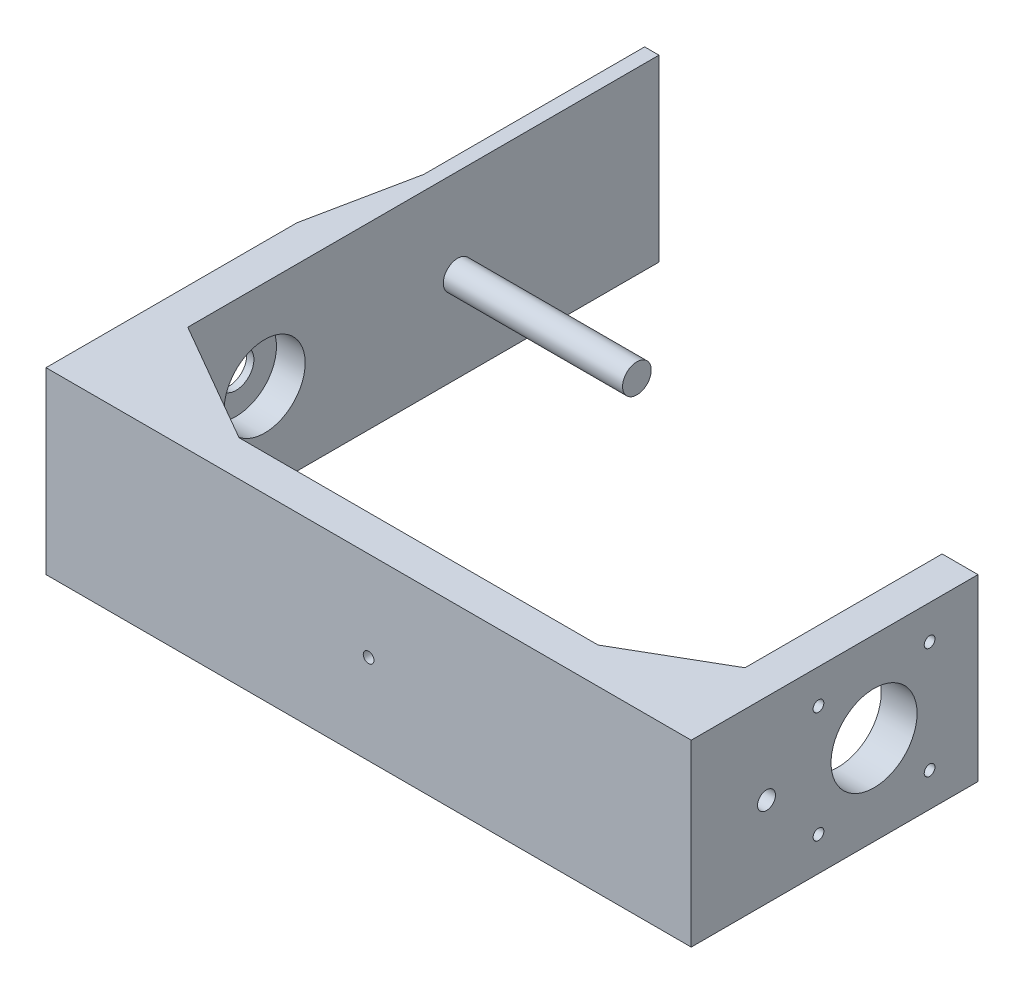
from build123d import *

# Parameters (mm, degrees)
BOSS_EXTRUDE1_DEPTH = 50
SKETCH3_R           = 2.5
SKETCH3_R_2         = 12
SKETCH3_R_3         = 1.5
CUT_EXTRUDE1_DEPTH  = 10
RIB1_REACH          = 129.376
SKETCH4_WALL_W      = 286.752677288
SKETCH4_WALL_H      = 6
MIRROR2_DEPTH       = 6
MIRROR2_START       = 44
MIRROR2_2_DEPTH     = 6
SKETCH5_R           = 11.3
SKETCH5_R_2         = 2.5
CUT_EXTRUDE2_DEPTH  = 8
SKETCH6_R           = 5
SKETCH6_R_2         = 0.75
CUT_EXTRUDE3_DEPTH  = 2
SKETCH8_W           = 4
SKETCH8_H           = 50
BOSS_EXTRUDE2_DEPTH = 91
BOSS_EXTRUDE3_DEPTH = 50
SKETCH11_R          = 1.5
CUT_EXTRUDE4_DEPTH  = 10
SKETCH12_R          = 4.004666462
BOSS_EXTRUDE4_DEPTH = 50


# Read off the part's stored shape, not the designer's step: Mirror2
with BuildPart() as part:
    # Sketch2 → Boss-Extrude1 (new body)
    with BuildSketch(Plane(origin=(0, 0, 0), x_dir=(1, 0, 0), z_dir=(0, 1, 0))):
        Polygon((-83.940042827, 0), (76.059957173, 0), (76.059957173, 70), (86.059957173, 70), (86.059957173, -10), (-93.940042827, -10), (-93.940042827, 60), (-83.940042827, 60), align=None)
    extrude(amount=BOSS_EXTRUDE1_DEPTH)

    # Sketch3 → Cut-Extrude1 (cut)
    with BuildSketch(Plane(origin=(86.059957173, 0, 0), x_dir=(0, 0, -1), z_dir=(1, 0, 0))):
        with Locations((11, 25)):
            Circle(SKETCH3_R)
        with Locations((41, 25)):
            Circle(SKETCH3_R_2)
        with Locations((25.500219356, 40.499780644)):
            Circle(SKETCH3_R_3)
        with Locations((56.499780644, 40.499780644)):
            Circle(SKETCH3_R_3)
        with Locations((56.499780644, 9.500219356)):
            Circle(SKETCH3_R_3)
        with Locations((25.500219356, 9.500219356)):
            Circle(SKETCH3_R_3)
    extrude(amount=-CUT_EXTRUDE1_DEPTH, mode=Mode.SUBTRACT)

    # Sketch4 wall → Rib1 (add, up to next)
    with BuildSketch(Plane(origin=(63.069576117, 50, -7.5), x_dir=(0.86602540378, 0, -0.500000000008), z_dir=(-0.500000000008, 0, -0.86602540378)), mode=Mode.PRIVATE) as rib1_sk1:
        with Locations((0, 3)):
            Rectangle(SKETCH4_WALL_W, SKETCH4_WALL_H)
    rib1_tool1 = extrude(rib1_sk1.sketch, amount=-RIB1_REACH, mode=Mode.PRIVATE) - part.part
    rib1 = rib1_tool1.solids().sort_by_distance((63.069576117, 50, -7.5))[0]
    add(rib1)

    # Mirror1: Rib1 across plane
    add(rib1.mirror(Plane.ZX.offset(25)))

    # Mirror2 outline → Mirror2 (add)
    with BuildSketch(Plane(origin=(0, 0, 0), x_dir=(1, 0, 0), z_dir=(0, 1, 0))):
        Polygon((-83.940042827, 0), (-50.07919506, 0), (-83.940042827, 19.549569573), align=None)
    extrude(amount=MIRROR2_DEPTH)

    # Mirror2 2 outline → Mirror2 2 (add)
    with BuildSketch(Plane(origin=(0, 0, 0), x_dir=(1, 0, 0), z_dir=(0, 1, 0)).offset(MIRROR2_START)):
        Polygon((-83.940042827, 0), (-50.07919506, 0), (-83.940042827, 19.549569573), align=None)
    extrude(amount=MIRROR2_2_DEPTH)

    # Sketch5 → Cut-Extrude2 (cut)
    with BuildSketch(Plane(origin=(-83.940042827, 0, 0), x_dir=(0, 0, -1), z_dir=(1, 0, 0))):
        with Locations((41, 25)):
            Circle(SKETCH5_R)
        with Locations((11, 25)):
            Circle(SKETCH5_R_2)
    extrude(amount=-CUT_EXTRUDE2_DEPTH, mode=Mode.SUBTRACT)

    # Sketch6 → Cut-Extrude3 (cut)
    with BuildSketch(Plane.ZY.offset(93.940042827)):
        with Locations((-41, 25)):
            Circle(SKETCH6_R)
        with Locations((-11, 25)):
            Circle(SKETCH6_R_2)
    extrude(amount=-CUT_EXTRUDE3_DEPTH, mode=Mode.SUBTRACT)

    # Sketch8 → Boss-Extrude2 (add)
    with BuildSketch(Plane(origin=(0, 0, -60), x_dir=(-1, 0, 0), z_dir=(0, 0, -1))):
        with Locations((85.940042827, 25)):
            Rectangle(SKETCH8_W, SKETCH8_H)
    extrude(amount=BOSS_EXTRUDE2_DEPTH)

    # Sketch9 → Boss-Extrude3 (add)
    with BuildSketch(Plane(origin=(0, 50, 0), x_dir=(1, 0, 0), z_dir=(0, 1, 0))):
        Polygon((-87.940042827, 89.393876913), (-93.940042827, 60), (-87.940042827, 60), align=None)
    extrude(amount=-BOSS_EXTRUDE3_DEPTH)

    # Sketch11 → Cut-Extrude4 (cut)
    with BuildSketch(Plane.XY.offset(10)):
        with Locations((-3.940042827, 25)):
            Circle(SKETCH11_R)
    extrude(amount=-CUT_EXTRUDE4_DEPTH, mode=Mode.SUBTRACT)

    # Sketch12 → Boss-Extrude4 (add)
    with BuildSketch(Plane(origin=(-83.940042827, 0, 0), x_dir=(0, 0, -1), z_dir=(1, 0, 0))):
        with Locations(Location((94.840711844, 25, 0), (0, 0, 180))):
            Circle(SKETCH12_R)
    extrude(amount=BOSS_EXTRUDE4_DEPTH)


solid = part.part
